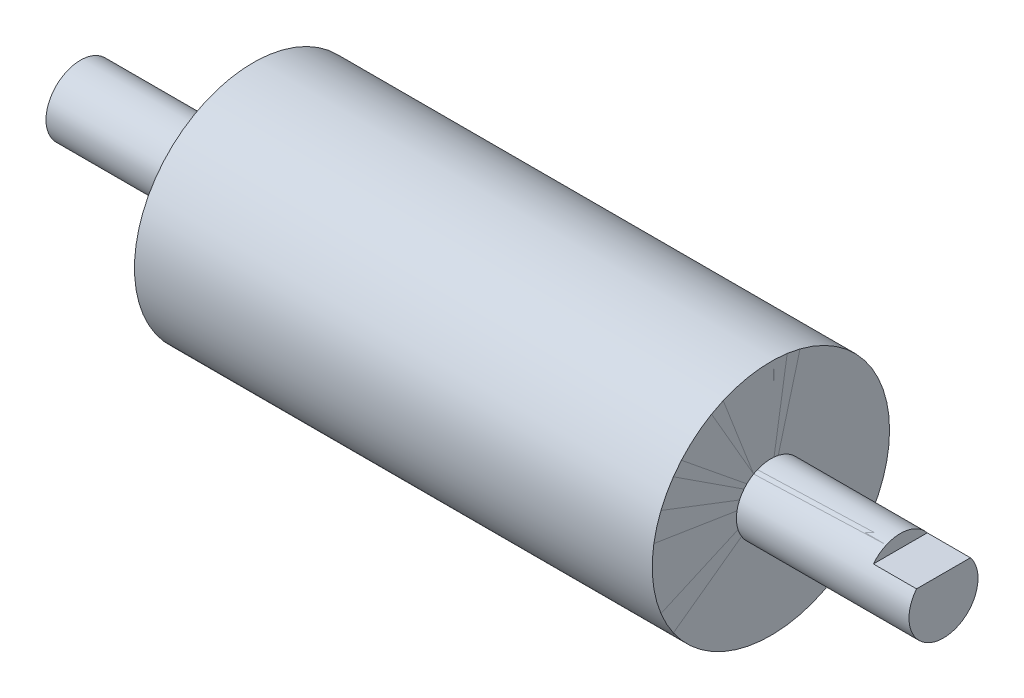
from build123d import *

# Parameters (mm, degrees)
SKETCH2_W                 = 120
SKETCH2_H                 = 27.5
SKETCH4_R                 = 8
BOSS_EXTRUDE1_DEPTH       = 100
SKETCH5_W                 = 26
SKETCH5_H                 = 5
CUT_EXTRUDE1_DEPTH        = 10
BODY_MOVE_COPY1_START     = -160
BODY_MOVE_COPY1_OUTLINE_R = 8
BODY_MOVE_COPY1_DEPTH     = 190
BODY_MOVE_COPY1_START_2   = 30
BODY_MOVE_COPY1_2_DEPTH   = 10


# Read off the part's stored shape, not the designer's step: Body-Move/Copy1
with BuildPart() as part:
    # Sketch1 → Revolve1 (revolve)
    with BuildSketch(Plane.XY):
        with BuildLine():
            Line((0, 0), (-120, 0))
            Line((-120, 0), (-120, 27.5))
            add(Edge.make_bspline(
                [(-120, 27.5), (-80.008293057, 22.546130336), (-40.008293057, 22.546130336), (0, 27.5)],
                knots=[0, 0, 0, 0, 1, 1, 1, 1], degree=3))
            Line((0, 27.5), (0, 0))
        make_face()
    revolve(axis=Axis((-120, 0, 0), (-1, 0, 0)))


with BuildPart() as body_2:
    # Sketch2 → Revolve2 (revolve)
    with BuildSketch(Plane.XY, mode=Mode.PRIVATE) as revolve2_sk:
        with Locations((-60, 13.75)):
            Rectangle(SKETCH2_W, SKETCH2_H)
    revolve(revolve2_sk.sketch.rotate(Axis((0, 0, 0), (-1, 0, 0)), 90), axis=Axis((0, 0, 0), (-1, 0, 0)))


with BuildPart() as body_3:
    # Sketch4 → Boss-Extrude1 (new, symmetric)
    with BuildSketch(Plane.ZY.offset(60)):
        Circle(SKETCH4_R)
    extrude(amount=BOSS_EXTRUDE1_DEPTH, both=True)

    # Sketch5 → Cut-Extrude1 (cut)
    with BuildSketch(Plane(origin=(40, 0, 0), x_dir=(0, 0, -1), z_dir=(1, 0, 0))):
        with Locations((0, 7.5)):
            Rectangle(SKETCH5_W, SKETCH5_H)
    extrude(amount=-CUT_EXTRUDE1_DEPTH, mode=Mode.SUBTRACT)

    # Combine1: union part
    add(part.part)


with BuildPart() as body_4:
    # Body-Move/Copy1 outline → Body-Move/Copy1 (new body)
    with BuildSketch(Plane.YZ.offset(BODY_MOVE_COPY1_START)):
        Circle(BODY_MOVE_COPY1_OUTLINE_R)
    extrude(amount=BODY_MOVE_COPY1_DEPTH)

    # Body-Move_Copy1 2 outline → Body-Move_Copy1 2 (add)
    with BuildSketch(Plane.YZ.offset(BODY_MOVE_COPY1_START_2)):
        with BuildLine():
            Line((5, -6.244997998), (5, 6.244997998))
            ThreePointArc((5, 6.244997998), (-8, 0), (5, -6.244997998))
        make_face()
    extrude(amount=BODY_MOVE_COPY1_2_DEPTH)


with BuildPart() as body_2_1:
    add(body_2.part)

    # Combine2: union body 4
    add(body_4.part)


solid = Compound([body_3.part, body_2_1.part])
